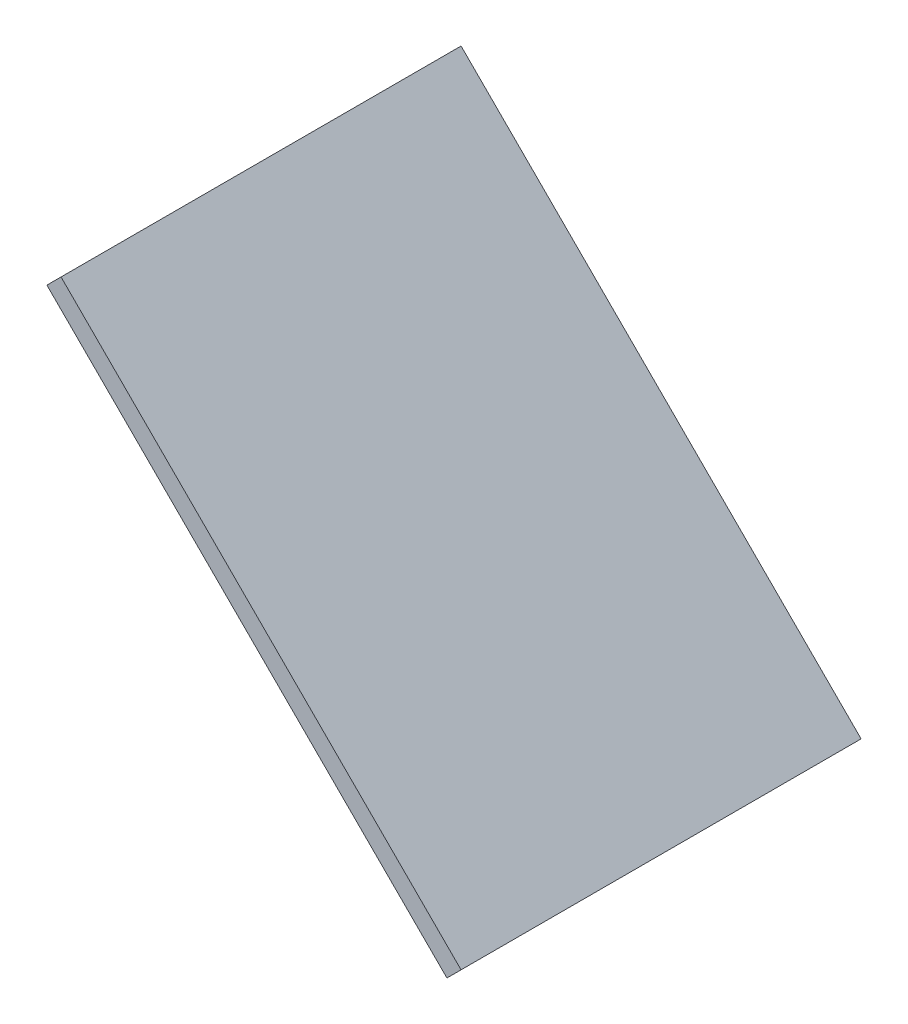
from build123d import *

# Parameters (mm, degrees)
BOSS_EXTRUDE1_DEPTH = 127


with BuildPart() as part:
    # Sketch1 → Boss-Extrude1 (new body)
    with BuildSketch(Plane.XY):
        Polygon((-127, 0), (0, -127), (4.490128061, -122.509871939), (-122.509871939, 4.490128061), align=None)
    extrude(amount=BOSS_EXTRUDE1_DEPTH)


solid = part.part
